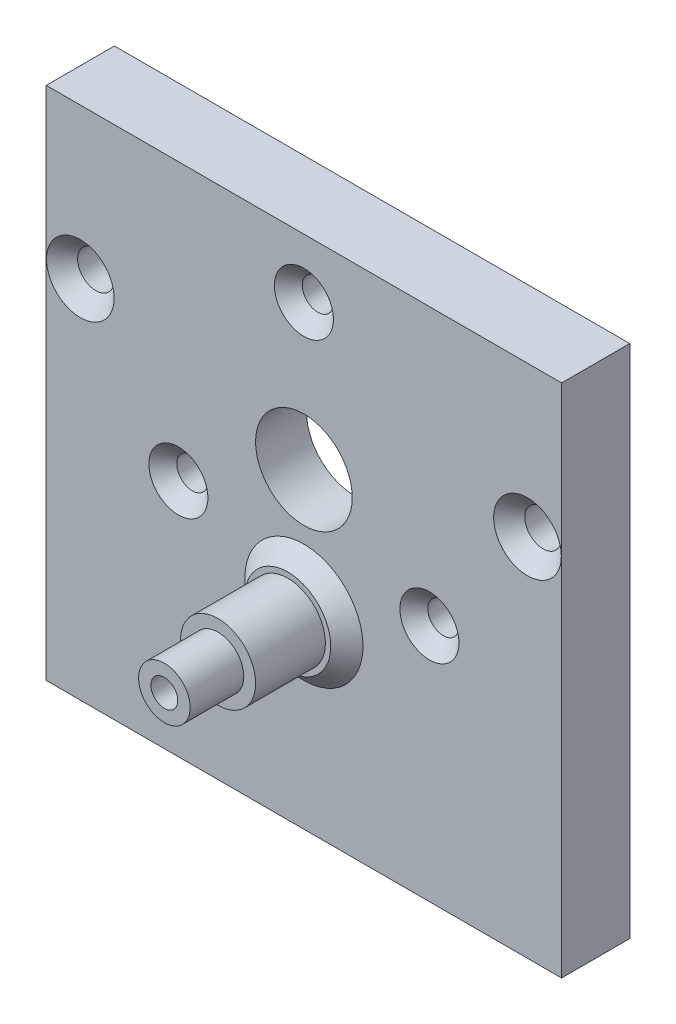
from build123d import *

# Parameters (mm, degrees)
ESBO_O1_W                                            = 48
ESBO_O1_H                                            = 48
RESSALTO_EXTRUS_O1_DEPTH                             = 6.35
ESBO_O3_R                                            = 6
RESSALTO_EXTRUS_O2_DEPTH                             = 13
CORTE_EXTRUS_O1_START                                = -5
ESBO_O4_R                                            = 6
ESBO_O4_R_2                                          = 2.4
CORTE_EXTRUS_O1_DEPTH                                = 5
CORTE_EXTRUS_O2_START                                = -6.5
ESBO_O5_R                                            = 6
ESBO_O5_R_2                                          = 3.5
CORTE_EXTRUS_O2_DEPTH                                = 6.5
FURO_ROSCADO_DE_M31_D                                = 2.5
FURO_ROSCADO_DE_M31_DEPTH                            = 8.5
FURO_ROSCADO_DE_M31_TIP                              = 0.751075774
ESCAREADO_PARA_PARAFUSO_COM_CABE_A_ESCAR_D           = 3.4
ESCAREADO_PARA_PARAFUSO_COM_CABE_A_ESCAR_DEPTH       = 10.778536948
ESCAREADO_PARA_PARAFUSO_COM_CABE_A_ESCAR_CSINK_D     = 6.3
ESCAREADO_PARA_PARAFUSO_COM_CABE_A_ESCAR_CSINK_ANGLE = 90
ESCAREADO_PARA_PARAFUSO_COM_CABE_A_ESCAR_TIP         = 1.021463052
FURO_ROSCADO_DE_M32_D                                = 2.5
FURO_ROSCADO_DE_M32_DEPTH                            = 9.248924226
FURO_ROSCADO_DE_M32_TIP                              = 0.751075774
CHANFRO4_SIZE                                        = 2
ESBO_O29_R                                           = 4.5
CORTE_EXTRUS_O3_DEPTH                                = 70.115844783
ESCAREADO_PARA_PARAFUSO_COM_CABE_A_E_2_D             = 2.9
ESCAREADO_PARA_PARAFUSO_COM_CABE_A_E_2_CSINK_D       = 5.5
ESCAREADO_PARA_PARAFUSO_COM_CABE_A_E_2_CSINK_ANGLE   = 90
ESBO_O32_R                                           = 17.5
CORTE_EXTRUS_O4_DEPTH                                = 1.6


with BuildPart() as part:
    # Esboço1 → Ressalto-extrusão1 (new body)
    with BuildSketch(Plane.XY):
        with Locations((24, 24)):
            Rectangle(ESBO_O1_W, ESBO_O1_H)
    extrude(amount=RESSALTO_EXTRUS_O1_DEPTH)

    # Esboço3 → Ressalto-extrusão2 (add)
    with BuildSketch(Plane.XY.offset(6.35)):
        with Locations(Location((24, 17.5, 0), (0, 0, 180))):
            Circle(ESBO_O3_R)
    extrude(amount=RESSALTO_EXTRUS_O2_DEPTH)

    # Esboço4 → Corte-extrusão1 (cut)
    with BuildSketch(Plane.XY.offset(19.35).offset(CORTE_EXTRUS_O1_START)):
        with Locations(Location((24, 17.5, 0), (0, 0, 180))):
            Circle(ESBO_O4_R)
        with Locations((24, 17.5)):
            Circle(ESBO_O4_R_2, mode=Mode.SUBTRACT)
    extrude(amount=CORTE_EXTRUS_O1_DEPTH, mode=Mode.SUBTRACT)

    # Esboço5 → Corte-extrusão2 (cut)
    with BuildSketch(Plane.XY.offset(14.35).offset(CORTE_EXTRUS_O2_START)):
        with Locations(Location((24, 17.5, 0), (0, 0, 180))):
            Circle(ESBO_O5_R)
        with Locations((24, 17.5)):
            Circle(ESBO_O5_R_2, mode=Mode.SUBTRACT)
    extrude(amount=CORTE_EXTRUS_O2_DEPTH, mode=Mode.SUBTRACT)

    # Furo roscado de M31
    with Locations(Plane(origin=(24, 17.5, 19.35), x_dir=(1, 0, 0), z_dir=(0, 0, 1))):
        with Locations((0, 0)):
            Hole(FURO_ROSCADO_DE_M31_D / 2, depth=FURO_ROSCADO_DE_M31_DEPTH)
            with Locations((0, 0, -(FURO_ROSCADO_DE_M31_DEPTH + FURO_ROSCADO_DE_M31_TIP / 2))):  # 118° drill point
                Cone(0, FURO_ROSCADO_DE_M31_D / 2, FURO_ROSCADO_DE_M31_TIP, mode=Mode.SUBTRACT)

    # Escareado para parafuso com cabe_a escar
    with Locations(Plane(origin=(44.825, 34, 6.35), x_dir=(1, 0, 0), z_dir=(0, 0, 1))):
        with Locations((0, 0), (-41.65, 0)):
            CounterSinkHole(ESCAREADO_PARA_PARAFUSO_COM_CABE_A_ESCAR_D / 2, ESCAREADO_PARA_PARAFUSO_COM_CABE_A_ESCAR_CSINK_D / 2, depth=ESCAREADO_PARA_PARAFUSO_COM_CABE_A_ESCAR_DEPTH, counter_sink_angle=ESCAREADO_PARA_PARAFUSO_COM_CABE_A_ESCAR_CSINK_ANGLE)
            with Locations((0, 0, -(ESCAREADO_PARA_PARAFUSO_COM_CABE_A_ESCAR_DEPTH + ESCAREADO_PARA_PARAFUSO_COM_CABE_A_ESCAR_TIP / 2))):  # 118° drill point
                Cone(0, ESCAREADO_PARA_PARAFUSO_COM_CABE_A_ESCAR_D / 2, ESCAREADO_PARA_PARAFUSO_COM_CABE_A_ESCAR_TIP, mode=Mode.SUBTRACT)

    # Furo roscado de M32
    with Locations(Plane(origin=(3.175, 0, 3.175), x_dir=(0, 0, -1), z_dir=(0, -1, 0))):
        with Locations((0, 0), (0, 41.65)):
            Hole(FURO_ROSCADO_DE_M32_D / 2, depth=FURO_ROSCADO_DE_M32_DEPTH)
            with Locations((0, 0, -(FURO_ROSCADO_DE_M32_DEPTH + FURO_ROSCADO_DE_M32_TIP / 2))):  # 118° drill point
                Cone(0, FURO_ROSCADO_DE_M32_D / 2, FURO_ROSCADO_DE_M32_TIP, mode=Mode.SUBTRACT)

    # Chanfro4
    # the kernel refuses this chamfer: 2 mm, written as the material it takes off along each edge
    with BuildSketch(Plane(origin=(24, 17.5, 7.85), x_dir=(-1, 0, 0), z_dir=(0, 1, 0))) as chanfro4_piece_1_section:
        Polygon((6, -CHANFRO4_SIZE), (6 - CHANFRO4_SIZE, 0), (6, 0), align=None)
    chanfro4_piece_1 = revolve(axis=Axis((24, 17.5, 7.85), (0, 0, 1)), mode=Mode.PRIVATE)
    chanfro4_piece_1 = split(chanfro4_piece_1, bisect_by=Plane(origin=(28.750537315, 17.5, 6.35), z_dir=(0, 0, 1)), keep=Keep.TOP, mode=Mode.PRIVATE)
    add(chanfro4_piece_1, mode=Mode.SUBTRACT)

    # Esboço29 → Corte-extrusão3 (cut, through all)
    with BuildSketch(Plane.XY.offset(6.35)):
        with Locations((24, 29)):
            Circle(ESBO_O29_R)
    extrude(amount=-CORTE_EXTRUS_O3_DEPTH, mode=Mode.SUBTRACT)

    # Escareado para parafuso com cabe_a e 2 (through all)
    with Locations(Plane(origin=(12.308657049, 22.25, 6.35), x_dir=(1, 0, 0), z_dir=(0, 0, 1))):
        with Locations((0, 0), (23.382685902, 0), (11.691342951, 20.25)):
            CounterSinkHole(ESCAREADO_PARA_PARAFUSO_COM_CABE_A_E_2_D / 2, ESCAREADO_PARA_PARAFUSO_COM_CABE_A_E_2_CSINK_D / 2, counter_sink_angle=ESCAREADO_PARA_PARAFUSO_COM_CABE_A_E_2_CSINK_ANGLE)

    # Esboço32 → Corte-extrusão4 (cut)
    with BuildSketch(Plane(origin=(0, 0, 0), x_dir=(-1, 0, 0), z_dir=(0, 0, -1))):
        with Locations((-24, 29)):
            Circle(ESBO_O32_R)
    extrude(amount=-CORTE_EXTRUS_O4_DEPTH, mode=Mode.SUBTRACT)


solid = part.part
